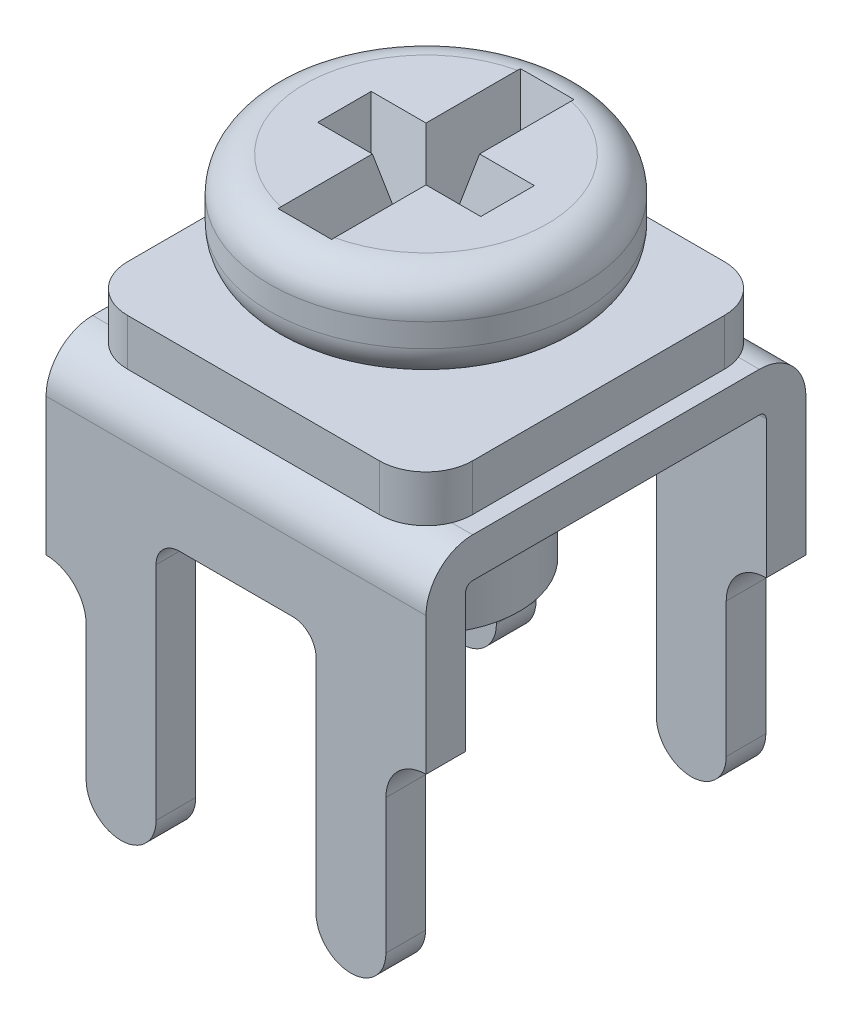
from build123d import *

# Parameters (mm, degrees)
EXTRUDE_THIN1_DEPTH               = 4.075
CUT_EXTRUDE1_DEPTH                = 8.45230669
CUT_EXTRUDE1_DEPTH_BACK           = 8.45230669
BOSS_EXTRUDE1_DEPTH               = 1
BOSS_EXTRUDE2_DEPTH               = 0.5
BOSS_EXTRUDE2_DEPTH_BACK          = 5
SKETCH5_R                         = 2
SKETCH6_R                         = 3.35
BOSS_EXTRUDE3_DEPTH               = 2
FILLET1_R                         = 0.75
SKETCH7_W                         = 1.15
SKETCH7_H                         = 5.2
CUT_EXTRUDE_THIN1_DEPTH           = 2
CUT_EXTRUDE_THIN1_DRAFT           = -13
SKETCH7_W_2                       = 3.5
SKETCH7_H_2                       = 1.15
CUT_EXTRUDE_THIN1_PROFILE_2_DEPTH = 2
CUT_EXTRUDE_THIN1_PROFILE_2_DRAFT = -13


with BuildPart() as part:
    # Sketch1 → Extrude-Thin1 (new, symmetric)
    with BuildSketch(Plane(origin=(0, 0, 0), x_dir=(0, 0, -1), z_dir=(1, 0, 0))):
        with BuildLine():
            Line((-4.075, -3.725), (-4.075, 3.725))
            ThreePointArc((-4.075, 3.725), (-3.782106781, 4.432106781), (-3.075, 4.725))
            Line((-3.075, 4.725), (3.075, 4.725))
            ThreePointArc((3.075, 4.725), (3.782106781, 4.432106781), (4.075, 3.725))
            Line((4.075, 3.725), (4.075, -3.725))
            Line((4.075, -3.725), (3.225, -3.725))
            Line((3.225, -3.725), (3.225, 3.725))
            ThreePointArc((3.225, 3.725), (3.181066017, 3.831066017), (3.075, 3.875))
            Line((3.075, 3.875), (-3.075, 3.875))
            ThreePointArc((-3.075, 3.875), (-3.181066017, 3.831066017), (-3.225, 3.725))
            Line((-3.225, 3.725), (-3.225, -3.725))
            Line((-3.225, -3.725), (-4.075, -3.725))
        make_face()
    extrude(amount=EXTRUDE_THIN1_DEPTH, both=True)

    # Sketch3 → Cut-Extrude1 (cut, two sides: drawn at the far end of the back side and taken through both)
    with BuildSketch(Plane.XY.offset(-CUT_EXTRUDE1_DEPTH_BACK)):
        with BuildLine():
            Line((-1.715, -3.725), (1.715, -3.725))
            Line((1.715, -3.725), (1.715, -3.972782835))
            Line((1.715, -3.972782835), (3.215, -3.972782835))
            Line((3.215, -3.972782835), (3.215, -3.725))
            Line((3.215, -3.725), (4.075, -3.725))
            Line((4.075, -3.725), (4.075, 0.775))
            ThreePointArc((4.075, 0.775), (3.466888168, 0.523111832), (3.215, -0.085))
            Line((3.215, -0.085), (3.215, -2.975))
            ThreePointArc((3.215, -2.975), (2.465, -3.725), (1.715, -2.975))
            Line((1.715, -2.975), (1.715, 1.775))
            ThreePointArc((1.715, 1.775), (1.568553391, 2.128553391), (1.215, 2.275))
            Line((1.215, 2.275), (-1.215, 2.275))
            ThreePointArc((-1.215, 2.275), (-1.568553391, 2.128553391), (-1.715, 1.775))
            Line((-1.715, 1.775), (-1.715, -2.975))
            ThreePointArc((-1.715, -2.975), (-2.465, -3.725), (-3.215, -2.975))
            Line((-3.215, -2.975), (-3.215, -0.085))
            ThreePointArc((-3.215, -0.085), (-3.466888168, 0.523111832), (-4.075, 0.775))
            Line((-4.075, 0.775), (-4.075, -3.725))
            Line((-4.075, -3.725), (-3.215, -3.725))
            Line((-3.215, -3.725), (-3.215, -3.972782835))
            Line((-3.215, -3.972782835), (-1.715, -3.972782835))
            Line((-1.715, -3.972782835), (-1.715, -3.725))
        make_face()
    extrude(amount=CUT_EXTRUDE1_DEPTH + CUT_EXTRUDE1_DEPTH_BACK, mode=Mode.SUBTRACT)

    # Sketch4 → Boss-Extrude1 (add)
    with BuildSketch(Plane(origin=(0, 4.725, 0), x_dir=(1, 0, 0), z_dir=(0, 1, 0))):
        with BuildLine():
            Line((-2.7, -3.7), (2.7, -3.7))
            ThreePointArc((2.7, -3.7), (3.407106781, -3.407106781), (3.7, -2.7))
            Line((3.7, -2.7), (3.7, 2.7))
            ThreePointArc((3.7, 2.7), (3.407106781, 3.407106781), (2.7, 3.7))
            Line((2.7, 3.7), (-2.7, 3.7))
            ThreePointArc((-2.7, 3.7), (-3.407106781, 3.407106781), (-3.7, 2.7))
            Line((-3.7, 2.7), (-3.7, -2.7))
            ThreePointArc((-3.7, -2.7), (-3.407106781, -3.407106781), (-2.7, -3.7))
        make_face()
    extrude(amount=BOSS_EXTRUDE1_DEPTH)

    # Sketch5 → Boss-Extrude2 (add, two sides: drawn at the far end of the back side and taken through both)
    with BuildSketch(Plane(origin=(0, 5.725, 0), x_dir=(1, 0, 0), z_dir=(0, 1, 0)).offset(-BOSS_EXTRUDE2_DEPTH_BACK)):
        Circle(SKETCH5_R)
    extrude(amount=BOSS_EXTRUDE2_DEPTH + BOSS_EXTRUDE2_DEPTH_BACK)

    # Sketch6 → Boss-Extrude3 (add)
    with BuildSketch(Plane(origin=(0, 6.225, 0), x_dir=(1, 0, 0), z_dir=(0, 1, 0))):
        Circle(SKETCH6_R)
    extrude(amount=BOSS_EXTRUDE3_DEPTH)

    # Fillet1
    fillet1_edges = [part.edges().sort_by_distance(p)[0] for p in [
        (-3.35, 6.225, 0),
        (-3.35, 8.225, 0),
    ]]
    fillet(fillet1_edges, radius=FILLET1_R)


with BuildPart() as cut_extrude_thin1_tool:
    # Sketch7 → Cut-Extrude-Thin1 (with draft: the straight prism first)
    with BuildSketch(Plane(origin=(0, 8.225, 0), x_dir=(1, 0, 0), z_dir=(0, 1, 0))):
        Rectangle(SKETCH7_W, SKETCH7_H)
    extrude(amount=-CUT_EXTRUDE_THIN1_DEPTH)
    # Cut-Extrude-Thin1: the draft: its side faces are tilted about the plane it starts from
    cut_extrude_thin1_sides = [cut_extrude_thin1_tool.faces().sort_by_distance(p)[0] for p in [
        (-0.575, 7.225, 0),
        (0, 7.225, 2.6),
        (0.575, 7.225, 0),
        (0, 7.225, -2.6),
    ]]
    draft(cut_extrude_thin1_sides, Plane(origin=(0, 8.225, 0), x_dir=(1, 0, 0), z_dir=(0, 1, 0)), CUT_EXTRUDE_THIN1_DRAFT)


with BuildPart() as part_1:
    add(part.part)

    # Cut-Extrude-Thin1: cut by cut_extrude_thin1_tool
    add(cut_extrude_thin1_tool.part, mode=Mode.SUBTRACT)


with BuildPart() as cut_extrude_thin1_profile_2_tool:
    # Sketch7 → Cut-Extrude-Thin1 profile 2 (with draft: the straight prism first)
    with BuildSketch(Plane(origin=(0, 8.225, 0), x_dir=(1, 0, 0), z_dir=(0, 1, 0))):
        Rectangle(SKETCH7_W_2, SKETCH7_H_2)
    extrude(amount=-CUT_EXTRUDE_THIN1_PROFILE_2_DEPTH)
    # Cut-Extrude-Thin1 profile 2: the draft: its side faces are tilted about the plane it starts from
    cut_extrude_thin1_profile_2_sides = [cut_extrude_thin1_profile_2_tool.faces().sort_by_distance(p)[0] for p in [
        (0, 7.225, -0.575),
        (-1.75, 7.225, 0),
        (0, 7.225, 0.575),
        (1.75, 7.225, 0),
    ]]
    draft(cut_extrude_thin1_profile_2_sides, Plane(origin=(0, 8.225, 0), x_dir=(1, 0, 0), z_dir=(0, 1, 0)), CUT_EXTRUDE_THIN1_PROFILE_2_DRAFT)


with BuildPart() as part_2:
    add(part_1.part)

    # Cut-Extrude-Thin1 profile 2: cut by cut_extrude_thin1_profile_2_tool
    add(cut_extrude_thin1_profile_2_tool.part, mode=Mode.SUBTRACT)


solid = part_2.part
